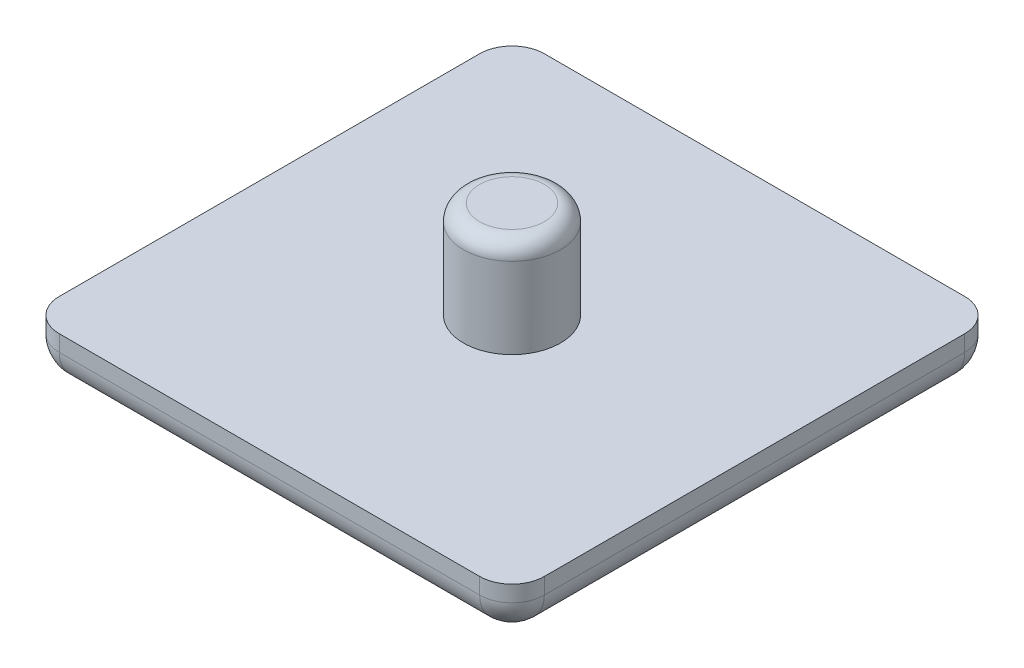
from build123d import *

# Parameters (mm, degrees)
SKETCH1_W           = 30
SKETCH1_H           = 30
BOSS_EXTRUDE1_DEPTH = 3
SKETCH3_R           = 3
BOSS_EXTRUDE2_DEPTH = 6
FILLET2_R           = 1
FILLET3_R           = 2
FILLET4_R           = 2
FILLET5_R           = 2
FILLET6_R           = 2


with BuildPart() as part:
    # Sketch1 → Boss-Extrude1 (new body)
    with BuildSketch(Plane(origin=(0, 0, 0), x_dir=(1, 0, 0), z_dir=(0, 1, 0))):
        with Locations((15, 15)):
            Rectangle(SKETCH1_W, SKETCH1_H)
    extrude(amount=BOSS_EXTRUDE1_DEPTH)

    # Sketch3 → Boss-Extrude2 (add)
    with BuildSketch(Plane(origin=(0, 3, 0), x_dir=(1, 0, 0), z_dir=(0, 1, 0))):
        with Locations(Location((15, 15, 0), (0, 0, 90))):
            Circle(SKETCH3_R)
    extrude(amount=BOSS_EXTRUDE2_DEPTH)

    # Fillet2
    fillet2_edges = [part.edges().sort_by_distance(p)[0] for p in [
        (15, 9, -12),
    ]]
    fillet(fillet2_edges, radius=FILLET2_R)

    # Fillet3
    fillet3_edges = [part.edges().sort_by_distance(p)[0] for p in [
        (15, 0, 0),
        (0, 0, -15),
    ]]
    fillet(fillet3_edges, radius=FILLET3_R)

    # Fillet4
    fillet4_edges = [part.edges().sort_by_distance(p)[0] for p in [
        (30, 0, -16),
        (0.585786438, 0.585786438, -30),
        (30, 0.585786438, -0.585786438),
        (16, 0, -30),
        (0, 2.5, -30),
        (30, 2.5, 0),
    ]]
    fillet(fillet4_edges, radius=FILLET4_R)

    # Fillet5
    # the kernel refuses this fillet: 2 mm, written as the material it takes off along each edge
    with BuildSketch(Plane(origin=(2, 2, -2), x_dir=(-1, 0, 0), z_dir=(0, 0, 1))) as fillet5_piece_1_section:
        Polygon((0, 0), (FILLET5_R, 0), (FILLET5_R, FILLET5_R), (0, FILLET5_R), align=None)
    fillet5_piece_1 = extrude(amount=FILLET5_R, mode=Mode.PRIVATE)
    fillet5_piece_1 = fillet5_piece_1 - Plane(origin=(2, 2, -2), x_dir=(0.7071067811865475, 0.7071067811865475, 0), z_dir=(0, 0, 1)) * Sphere(FILLET5_R, mode=Mode.PRIVATE)
    add(fillet5_piece_1, mode=Mode.SUBTRACT)
    with BuildSketch(Plane(origin=(0, 2, 0), x_dir=(1, 0, 0), z_dir=(0, 1, 0))) as fillet5_piece_2:
        with BuildLine():
            CenterArc((FILLET5_R, FILLET5_R), FILLET5_R, 180, 90)
            Line((0, FILLET5_R), (0, 0))
            Line((0, 0), (FILLET5_R, 0))
        make_face()
    extrude(amount=6, mode=Mode.SUBTRACT)

    # Fillet6
    # the kernel refuses this fillet: 2 mm, written as the material it takes off along each edge
    with BuildSketch(Plane(origin=(28, 2, -28), x_dir=(0, 0, -1), z_dir=(1, 0, 0))) as fillet6_piece_1_section:
        Polygon((0, 0), (FILLET6_R, 0), (FILLET6_R, -FILLET6_R), (0, -FILLET6_R), align=None)
    fillet6_piece_1 = extrude(amount=FILLET6_R, mode=Mode.PRIVATE)
    fillet6_piece_1 = fillet6_piece_1 - Plane(origin=(28, 2, -28), x_dir=(0, 0.7071067811865475, 0.7071067811865475), z_dir=(1, 0, 0)) * Sphere(FILLET6_R, mode=Mode.PRIVATE)
    add(fillet6_piece_1, mode=Mode.SUBTRACT)
    with BuildSketch(Plane(origin=(30, 2, -30), x_dir=(0, 0, 1), z_dir=(0, 1, 0))) as fillet6_piece_2:
        with BuildLine():
            CenterArc((FILLET6_R, -FILLET6_R), FILLET6_R, 90, 90)
            Line((0, -FILLET6_R), (0, 0))
            Line((0, 0), (FILLET6_R, 0))
        make_face()
    extrude(amount=6, mode=Mode.SUBTRACT)


solid = part.part
